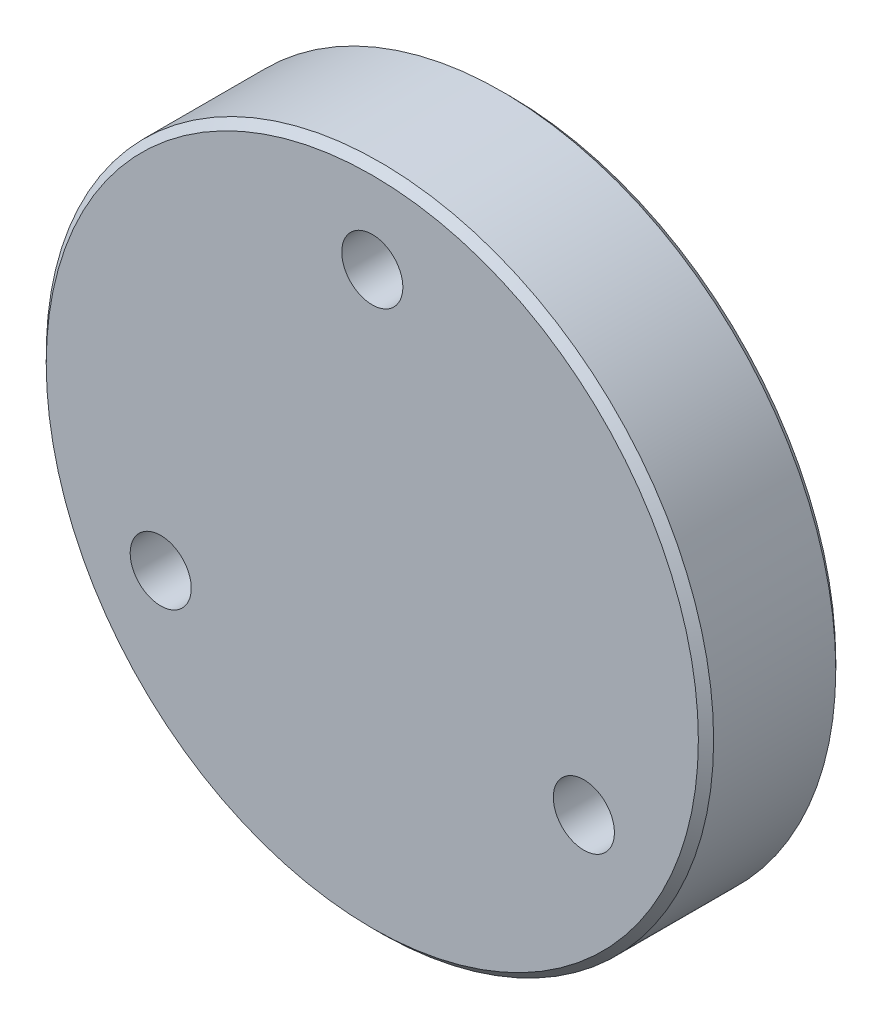
from build123d import *

# Parameters (mm, degrees)
SKETCH1_R           = 34.694413408
BOSS_EXTRUDE1_DEPTH = 14.2875
HOLE1_OUTLINE_R     = 6.35
HOLE1_DEPTH         = 5.08
HOLE1_START         = 5.08
HOLE1_2_OUTLINE_R   = 3.175
HOLE1_2_DEPTH       = 9.2075
CHAMFER1_SIZE       = 0.79375
SKETCH9_R           = 3.571875
CUT_EXTRUDE1_DEPTH  = 6.35
SKETCH10_R          = 2.758039836
CUT_EXTRUDE2_DEPTH  = 25.4
CHAMFER2_SIZE       = 0.396875


# Read off the part's stored shape, not the designer's step: Hole1
with BuildPart() as part:
    # Sketch1 → Boss-Extrude1 (new body)
    with BuildSketch(Plane.XY):
        Circle(SKETCH1_R)
    extrude(amount=BOSS_EXTRUDE1_DEPTH)

    # Hole1 outline → Hole1 (cut)
    with BuildSketch(Plane.XY):
        with Locations((21.997045256, -12.7)):
            Circle(HOLE1_OUTLINE_R)
        with Locations((-21.997045256, -12.7)):
            Circle(HOLE1_OUTLINE_R)
        with Locations((0, 25.4)):
            Circle(HOLE1_OUTLINE_R)
    extrude(amount=HOLE1_DEPTH, mode=Mode.SUBTRACT)

    # Hole1 2 outline → Hole1 2 (cut)
    with BuildSketch(Plane.XY.offset(HOLE1_START)):
        with Locations((21.997045256, -12.7)):
            Circle(HOLE1_2_OUTLINE_R)
        with Locations((-21.997045256, -12.7)):
            Circle(HOLE1_2_OUTLINE_R)
        with Locations((0, 25.4)):
            Circle(HOLE1_2_OUTLINE_R)
    extrude(amount=HOLE1_2_DEPTH, mode=Mode.SUBTRACT)

    # Chamfer1
    chamfer1_edges = [part.edges().sort_by_distance(p)[0] for p in [
        (-34.694413408, 0, 0),
        (-34.694413408, 0, 14.2875),
    ]]
    chamfer(chamfer1_edges, length=CHAMFER1_SIZE)

    # Sketch9 → Cut-Extrude1 (cut)
    with BuildSketch(Plane(origin=(0, -34.694413408, 0), x_dir=(-1, 0, 0), z_dir=(0, -1, 0))):
        with Locations(Location((0, -7.14375, 0), (0, 0, 90))):
            Circle(SKETCH9_R)
    extrude(amount=-CUT_EXTRUDE1_DEPTH, mode=Mode.SUBTRACT)

    # Sketch10 → Cut-Extrude2 (cut)
    with BuildSketch(Plane(origin=(0, -28.344413408, 0), x_dir=(-1, 0, 0), z_dir=(0, -1, 0))):
        with Locations(Location((0, -7.14375, 0), (0, 0, 90))):
            Circle(SKETCH10_R)
    extrude(amount=-CUT_EXTRUDE2_DEPTH, mode=Mode.SUBTRACT)

    # Chamfer2
    chamfer2_edges = [part.edges().sort_by_distance(p)[0] for p in [
        (-28.347045256, -12.7, 0),
        (-6.35, 25.4, 0),
        (15.647045256, -12.7, 0),
    ]]
    chamfer(chamfer2_edges, length=CHAMFER2_SIZE)


solid = part.part
